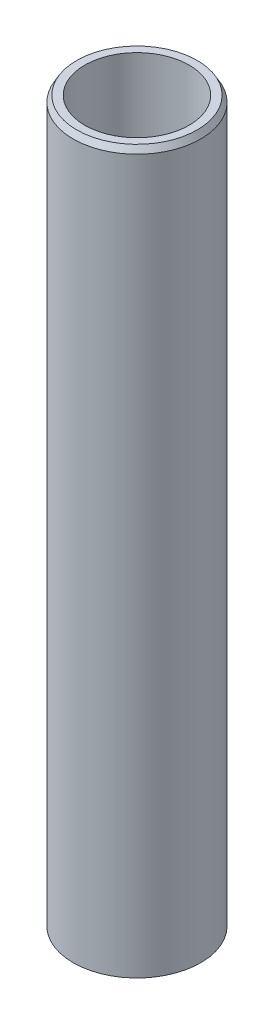
from build123d import *
from OCP.BRepFilletAPI import BRepFilletAPI_MakeChamfer

# Parameters (mm, degrees)
SKETCH1_R           = 30
BOSS_EXTRUDE1_DEPTH = 340.24724608
SKETCH2_R           = 24.548810585
CUT_EXTRUDE1_DEPTH  = 343.882178693
CHAMFER1_SIZE       = 2.87217856
CHAMFER1_SIZE2      = 1.658253065


with BuildPart() as part:
    # Sketch1 → Boss-Extrude1 (new body)
    with BuildSketch(Plane(origin=(0, 0, 0), x_dir=(1, 0, 0), z_dir=(0, 1, 0))):
        Circle(SKETCH1_R)
    extrude(amount=BOSS_EXTRUDE1_DEPTH)

    # Sketch2 → Cut-Extrude1 (cut, through all)
    with BuildSketch(Plane(origin=(0, 0, 0), x_dir=(1, 0, 0), z_dir=(0, 1, 0))):
        Circle(SKETCH2_R)
    extrude(amount=CUT_EXTRUDE1_DEPTH, mode=Mode.SUBTRACT)

    # Chamfer1: one chamfer whose edges measure the first distance from different faces: ONE call of the kernel's chamfer builder (chamfer() names one face for all edges)
    chamfer1_edges_1 = [part.edges().sort_by_distance(p)[0] for p in [
        (-30, 340.24724608, 0),
    ]]
    chamfer1_side_1 = [part.faces().sort_by_distance(p)[0] for p in [
        (-30, 170.12362304, 0),
    ]]
    chamfer1_edges_2 = [part.edges().sort_by_distance(p)[0] for p in [
        (-30, 0, 0),
    ]]
    chamfer1_side_2 = [part.faces().sort_by_distance(p)[0] for p in [
        (-29.151471863, 0, 0),
    ]]
    chamfer1 = BRepFilletAPI_MakeChamfer(part.part.solid().wrapped)
    for e in chamfer1_edges_1:
        chamfer1.Add(CHAMFER1_SIZE, CHAMFER1_SIZE2, e.wrapped, chamfer1_side_1[0].wrapped)  # the first distance lies on this face
    for e in chamfer1_edges_2:
        chamfer1.Add(CHAMFER1_SIZE, CHAMFER1_SIZE2, e.wrapped, chamfer1_side_2[0].wrapped)  # the first distance lies on this face
    add(Compound.cast(chamfer1.Shape()), mode=Mode.REPLACE)


solid = part.part
